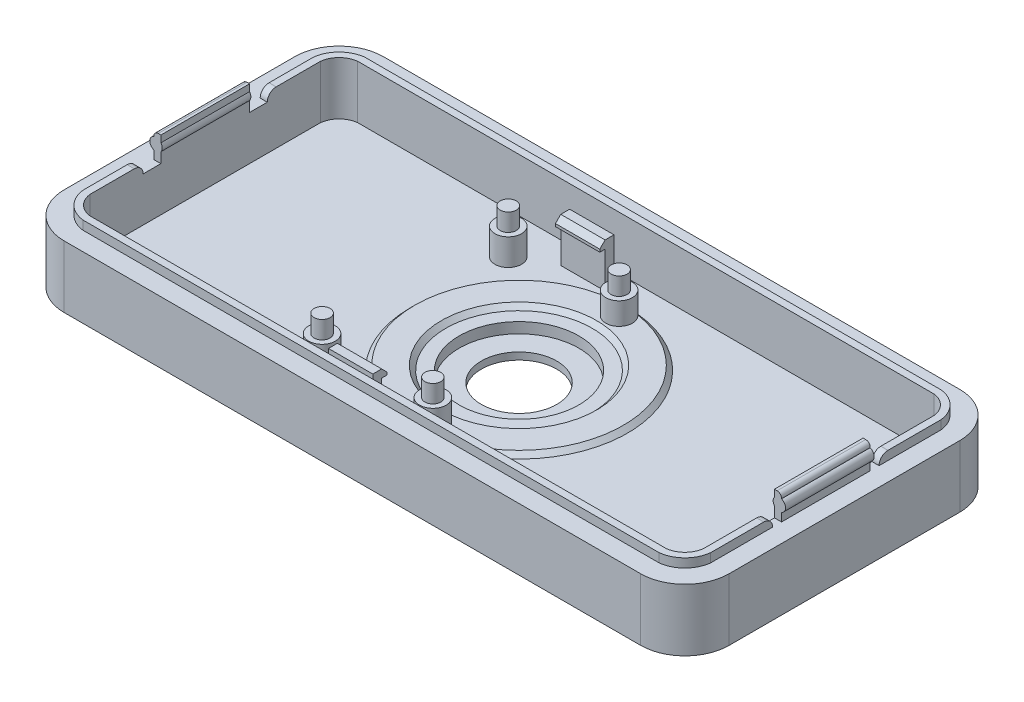
from build123d import *

# Parameters (mm, degrees)
EXTRUDE_2_DEPTH     = 7
EXTRUDE_4_DEPTH     = 1
SKETCH_7_W          = 0.8
SKETCH_7_H          = 10
EXTRUDE_8_DEPTH     = 2.8
SKETCH_8_R          = 0.7
EXTRUDE_9_DEPTH     = 10
FILLET_3_R          = 0.5
SKETCH_13_W         = 0.8
SKETCH_13_H         = 2
CUT_EXTRUDE_2_DEPTH = 1
CUT_EXTRUDE_START   = -5
CUT_EXTRUDE_3_DEPTH = 5
SKETCH_19_R         = 4.25
CUT_EXTRUDE_4_DEPTH = 3
SKETCH_21_R         = 1.5
EXTRUDE_11_DEPTH    = 3
SKETCH_22_R         = 0.9
EXTRUDE_12_DEPTH    = 2
SKETCH_28_W         = 5
SKETCH_28_H         = 1
EXTRUDE_16_DEPTH    = 5
FILLET_4_R          = 1
SKETCH_29_W         = 5
SKETCH_29_H         = 0.9
EXTRUDE_17_DEPTH    = 0.6
SKETCH_30_W         = 5
SKETCH_30_H         = 0.9
EXTRUDE_18_DEPTH    = 0.6
CHAMFER_5_SIZE      = 0.6
CUT_EXTRUDE_5_DEPTH = 0.5
SKETCH_34_W         = 0.8
SKETCH_34_H         = 12
CUT_EXTRUDE_6_DEPTH = 1
SKETCH_35_W         = 0.8
SKETCH_35_H         = 10
EXTRUDE_19_DEPTH    = 2.8
SKETCH_36_R         = 0.7
EXTRUDE_20_DEPTH    = 10
FILLET_5_R          = 0.5
FILLET_6_R          = 1
SKETCH_37_R         = 11.75
SKETCH_37_R_2       = 9.25
CUT_EXTRUDE_7_DEPTH = 1.5
CHAMFER_6_SIZE      = 1.2
CHAMFER_7_SIZE      = 0.5
SKETCH_38_R         = 12.25
SKETCH_38_R_2       = 8.25
EXTRUDE_21_DEPTH    = 0.5
CHAMFER_8_SIZE      = 0.5
SKETCH_39_R         = 6.751783721
CUT_EXTRUDE_8_DEPTH = 1.2


# Some blends are built 0.0001 mm under size
with BuildPart() as part:
    # case 2 → 凸台-拉伸2 (new body)
    with BuildSketch(Plane(origin=(0, 0, 0), x_dir=(1, 0, 0), z_dir=(0, 1, 0))):
        with BuildLine():
            Line((-34.042196447, 18), (30.957803553, 18))
            ThreePointArc((30.957803553, 18), (34.493337459, 16.535533906), (35.957803553, 13))
            Line((35.957803553, 13), (35.957803553, -13))
            ThreePointArc((35.957803553, -13), (34.493337459, -16.535533906), (30.957803553, -18))
            Line((30.957803553, -18), (-34.042196447, -18))
            ThreePointArc((-34.042196447, -18), (-37.577730353, -16.535533906), (-39.042196447, -13))
            Line((-39.042196447, -13), (-39.042196447, 13))
            ThreePointArc((-39.042196447, 13), (-37.577730353, 16.535533906), (-34.042196447, 18))
        make_face()
    extrude(amount=EXTRUDE_2_DEPTH)

    # 草图3 → 凸台-拉伸4 (add)
    with BuildSketch(Plane(origin=(0, 7, 0), x_dir=(1, 0, 0), z_dir=(0, 1, 0))):
        with BuildLine():
            Line((-36.942196447, 13), (-36.942196447, -13))
            ThreePointArc((-36.942196447, -13), (-35.997398295, -14.955201848), (-34.042196447, -15.9))
            Line((-34.042196447, -15.9), (30.957803553, -15.9))
            ThreePointArc((30.957803553, -15.9), (32.913005401, -14.955201848), (33.857803553, -13))
            Line((33.857803553, -13), (33.857803553, 13))
            ThreePointArc((33.857803553, 13), (32.913005401, 14.955201848), (30.957803553, 15.9))
            Line((30.957803553, 15.9), (-34.042196447, 15.9))
            ThreePointArc((-34.042196447, 15.9), (-35.997398295, 14.955201848), (-36.942196447, 13))
        make_face()
        with BuildLine():
            Line((-34.042196447, -15.1), (30.957803553, -15.1))
            ThreePointArc((30.957803553, -15.1), (32.371630665, -14.413827112), (33.057803553, -13))
            Line((33.057803553, -13), (33.057803553, 13))
            ThreePointArc((33.057803553, 13), (32.371630665, 14.413827112), (30.957803553, 15.1))
            Line((30.957803553, 15.1), (-34.042196447, 15.1))
            ThreePointArc((-34.042196447, 15.1), (-35.456023559, 14.413827112), (-36.142196447, 13))
            Line((-36.142196447, 13), (-36.142196447, -13))
            ThreePointArc((-36.142196447, -13), (-35.456023559, -14.413827112), (-34.042196447, -15.1))
        make_face(mode=Mode.SUBTRACT)
    extrude(amount=EXTRUDE_4_DEPTH)

    # 草图7 → 凸台-拉伸8 (add)
    with BuildSketch(Plane(origin=(0, 7, 0), x_dir=(1, 0, 0), z_dir=(0, 1, 0))):
        with Locations((-36.542196447, 0)):
            Rectangle(SKETCH_7_W, SKETCH_7_H)
    extrude(amount=EXTRUDE_8_DEPTH)

    # 草图8 → 凸台-拉伸9 (add)
    with BuildSketch(Plane.XY.offset(5)):
        with Locations((-36.692196447, 8.6)):
            Circle(SKETCH_8_R)
    extrude(amount=-EXTRUDE_9_DEPTH)

    # 圆角3
    fillet_3_edges = [part.edges().sort_by_distance(p)[0] for p in [
        (-36.942196447, 9.8, 0),
    ]]
    fillet(fillet_3_edges, radius=FILLET_3_R)

    # 草图13 → 切除-拉伸2 (cut)
    with BuildSketch(Plane(origin=(0, 8, 0), x_dir=(1, 0, 0), z_dir=(0, 1, 0))):
        with Locations((-36.542196447, -6)):
            Rectangle(SKETCH_13_W, SKETCH_13_H)
        with Locations((-36.542196447, 6)):
            Rectangle(SKETCH_13_W, SKETCH_13_H)
    extrude(amount=-CUT_EXTRUDE_2_DEPTH, mode=Mode.SUBTRACT)

    # 草图15 → 切除-拉伸3 (cut)
    with BuildSketch(Plane(origin=(0, 7, 0), x_dir=(1, 0, 0), z_dir=(0, 1, 0)).offset(CUT_EXTRUDE_START)):
        with BuildLine():
            Line((-34.042196447, -15.1), (30.957803553, -15.1))
            ThreePointArc((30.957803553, -15.1), (32.371630665, -14.413827112), (33.057803553, -13))
            Line((33.057803553, -13), (33.057803553, 13))
            ThreePointArc((33.057803553, 13), (32.371630665, 14.413827112), (30.957803553, 15.1))
            Line((30.957803553, 15.1), (-34.042196447, 15.1))
            ThreePointArc((-34.042196447, 15.1), (-35.456023559, 14.413827112), (-36.142196447, 13))
            Line((-36.142196447, 13), (-36.142196447, -13))
            ThreePointArc((-36.142196447, -13), (-35.456023559, -14.413827112), (-34.042196447, -15.1))
        make_face()
    extrude(amount=CUT_EXTRUDE_3_DEPTH, mode=Mode.SUBTRACT)

    # 草图19 → 切除-拉伸4 (cut)
    with BuildSketch(Plane(origin=(0, 2, 0), x_dir=(1, 0, 0), z_dir=(0, 1, 0))):
        with Locations(Location((-0.749999997, 0, 0), (0, 0, 270))):
            Circle(SKETCH_19_R)
    extrude(amount=-CUT_EXTRUDE_4_DEPTH, mode=Mode.SUBTRACT)

    # 草图21 → 凸台-拉伸11 (add)
    with BuildSketch(Plane(origin=(0, 2, 0), x_dir=(1, 0, 0), z_dir=(0, 1, 0))):
        with Locations(Location((-12.465269631, 10.5, 0), (0, 0, 270))):
            Circle(SKETCH_21_R)
        with Locations(Location((0.034730369, 10.5, 0), (0, 0, 270))):
            Circle(SKETCH_21_R)
        with Locations(Location((-12.465269631, -10.5, 0), (0, 0, 270))):
            Circle(SKETCH_21_R)
        with Locations(Location((0.034730369, -10.5, 0), (0, 0, 270))):
            Circle(SKETCH_21_R)
    extrude(amount=EXTRUDE_11_DEPTH)

    # 草图22 → 凸台-拉伸12 (add)
    with BuildSketch(Plane(origin=(0, 5, 0), x_dir=(1, 0, 0), z_dir=(0, 1, 0))):
        with Locations(Location((-12.465269631, -10.5, 0), (0, 0, 270))):
            Circle(SKETCH_22_R)
        with Locations(Location((0.034730369, -10.5, 0), (0, 0, 270))):
            Circle(SKETCH_22_R)
        with Locations(Location((-12.465269631, 10.5, 0), (0, 0, 270))):
            Circle(SKETCH_22_R)
        with Locations(Location((0.034730369, 10.5, 0), (0, 0, 270))):
            Circle(SKETCH_22_R)
    extrude(amount=EXTRUDE_12_DEPTH)

    # 草图28 → 凸台-拉伸16 (add)
    with BuildSketch(Plane(origin=(0, 2, 0), x_dir=(1, 0, 0), z_dir=(0, 1, 0))):
        with Locations((-6.142196447, -13.1)):
            Rectangle(SKETCH_28_W, SKETCH_28_H)
        with Locations((-6.142196447, 13.1)):
            Rectangle(SKETCH_28_W, SKETCH_28_H)
    extrude(amount=EXTRUDE_16_DEPTH)

    # 圆角4
    fillet_4_edges = [part.edges().sort_by_distance(p)[0] for p in [
        (-6.142196447, 2, 13.6),
        (-6.142196447, 2, -13.6),
    ]]
    fillet(fillet_4_edges, radius=FILLET_4_R)

    # 草图29 → 凸台-拉伸17 (add)
    with BuildSketch(Plane(origin=(0, 0, 12.6), x_dir=(-1, 0, 0), z_dir=(0, 0, -1))):
        with Locations((6.142196447, 6.55)):
            Rectangle(SKETCH_29_W, SKETCH_29_H)
    extrude(amount=EXTRUDE_17_DEPTH)

    # 草图30 → 凸台-拉伸18 (add)
    with BuildSketch(Plane.XY.offset(-12.6)):
        with Locations((-6.142196447, 6.55)):
            Rectangle(SKETCH_30_W, SKETCH_30_H)
    extrude(amount=EXTRUDE_18_DEPTH)

    # 倒角5
    chamfer_5_edges = [part.edges().sort_by_distance(p)[0] for p in [
        (-6.142196447, 7, 12),
        (-6.142196447, 7, -12),
    ]]
    chamfer(chamfer_5_edges, length=CHAMFER_5_SIZE)

    # 草图33 → 切除-拉伸5 (cut)
    with BuildSketch(Plane.XZ):
        with BuildLine():
            Line((31.452844049, 12.8823111), (31.128302993, 13.069384422))
            Line((31.128302993, 13.069384422), (29.444684359, 14.04079281))
            Line((29.444684359, 14.04079281), (29.120143303, 14.230122183))
            add(Edge.make_bspline(
                [(29.120143303, 14.230122183), (29.014191488, 14.288710703), (28.897014448, 14.320267891), (28.779809896, 14.320267891)],
                knots=[3, 3, 3, 3, 4, 4, 4, 4], degree=3))
            add(Edge.make_bspline(
                [(28.779809896, 14.320267891), (28.662605343, 14.320267891), (28.545400791, 14.288710703), (28.439476489, 14.230122183)],
                knots=[4, 4, 4, 4, 5, 5, 5, 5], degree=3))
            Line((28.439476489, 14.230122183), (28.11490792, 14.04079281))
            Line((28.11490792, 14.04079281), (26.431289286, 13.069384422))
            Line((26.431289286, 13.069384422), (26.106720717, 12.8823111))
            add(Edge.make_bspline(
                [(26.106720717, 12.8823111), (25.897128163, 12.760608203), (25.76638731, 12.535223299), (25.76638731, 12.2940598)],
                knots=[8, 8, 8, 8, 9, 9, 9, 9], degree=3))
            Line((25.76638731, 12.2940598), (25.76638731, 9.59845139))
            add(Edge.make_bspline(
                [(25.76638731, 9.59845139), (25.76638731, 9.355045597), (25.897128163, 9.131902987), (26.106720717, 9.01020009)],
                knots=[10, 10, 10, 10, 11, 11, 11, 11], degree=3))
            Line((26.106720717, 9.01020009), (26.431289286, 8.823126768))
            Line((26.431289286, 8.823126768), (28.11490792, 7.851718379))
            Line((28.11490792, 7.851718379), (28.439476489, 7.662402763))
            add(Edge.make_bspline(
                [(28.439476489, 7.662402763), (28.545400791, 7.601544437), (28.662605343, 7.572243299), (28.779809896, 7.572243299)],
                knots=[14, 14, 14, 14, 15, 15, 15, 15], degree=3))
            add(Edge.make_bspline(
                [(28.779809896, 7.572243299), (28.897014448, 7.572243299), (29.014191488, 7.601544437), (29.120143303, 7.662402763)],
                knots=[15, 15, 15, 15, 16, 16, 16, 16], degree=3))
            Line((29.120143303, 7.662402763), (29.444684359, 7.851718379))
            Line((29.444684359, 7.851718379), (31.128302993, 8.823126768))
            Line((31.128302993, 8.823126768), (31.452844049, 9.01020009))
            add(Edge.make_bspline(
                [(31.452844049, 9.01020009), (31.664720166, 9.131902987), (31.793177456, 9.355045597), (31.793177456, 9.59845139)],
                knots=[19, 19, 19, 19, 20, 20, 20, 20], degree=3))
            Line((31.793177456, 9.59845139), (31.793177456, 12.2940598))
            add(Edge.make_bspline(
                [(31.793177456, 12.2940598), (31.793177456, 12.535223299), (31.664720166, 12.760608203), (31.452844049, 12.8823111)],
                knots=[21, 21, 21, 21, 22, 22, 22, 22], degree=3))
        make_face()
        with BuildLine():
            Line((26.539469638, 12.614102513), (28.622023955, 13.817663956))
            add(Edge.make_bspline(
                [(28.622023955, 13.817663956), (28.71895157, 13.874010182), (28.840668222, 13.874010182), (28.939824374, 13.817663956)],
                knots=[3, 3, 3, 3, 4, 4, 4, 4], degree=3))
            Line((28.939824374, 13.817663956), (31.011098441, 12.611846463))
            add(Edge.make_bspline(
                [(31.011098441, 12.611846463), (31.117022743, 12.551001893), (31.119278793, 12.397741809), (31.013354491, 12.334627432)],
                knots=[5, 5, 5, 5, 6, 6, 6, 6], degree=3))
            Line((31.013354491, 12.334627432), (29.0006827, 11.131079746))
            add(Edge.make_bspline(
                [(29.0006827, 11.131079746), (28.865429747, 11.052186775), (28.696391069, 11.052186775), (28.561165629, 11.131079746)],
                knots=[7, 7, 7, 7, 8, 8, 8, 8], degree=3))
            add(Edge.make_bspline(
                [(28.561165629, 11.131079746), (26.5237048, 12.307582344), (26.5191927, 12.309838394)],
                knots=[0, 0, 0, 1, 1, 1], degree=2))
            add(Edge.make_bspline(
                [(26.5191927, 12.309838394), (26.413268398, 12.386461558), (26.424521136, 12.548745843), (26.539469638, 12.614102513)],
                knots=[1, 1, 1, 1, 2, 2, 2, 2], degree=3))
        make_face(mode=Mode.SUBTRACT)
        with BuildLine():
            Line((29.625003288, 9.091335354), (29.390594183, 8.960622014))
            Line((29.390594183, 8.960622014), (29.390594183, 9.388845079))
            Line((29.390594183, 9.388845079), (29.597930687, 9.492527088))
            add(Edge.make_bspline(
                [(29.976589432, 10.040210755), (29.976589432, 9.826092344), (29.854900293, 9.636776728), (29.597930687, 9.492527088)],
                knots=[0, 0, 0, 0, 1, 1, 1, 1], degree=3))
            add(Edge.make_bspline(
                [(29.584421899, 10.114591625), (29.836851892, 10.258827509), (29.976589432, 10.261083559), (29.976589432, 10.040210755)],
                knots=[6, 6, 6, 6, 7, 7, 7, 7], degree=3))
            Line((29.584421899, 10.114591625), (29.390594183, 10.006397517))
            add(Edge.make_bspline(
                [(29.368033682, 9.968085935), (29.368033682, 9.983864529), (29.377057883, 9.999643123), (29.390594183, 10.006397517)],
                knots=[4, 4, 4, 4, 5, 5, 5, 5], degree=3))
            Line((29.368033682, 9.968085935), (29.368033682, 9.436180861))
            Line((29.368033682, 9.436180861), (29.368033682, 8.922296676))
            Line((29.368033682, 8.922296676), (29.368033682, 8.246141962))
            add(Edge.make_bspline(
                [(29.368033682, 8.246141962), (29.368033682, 8.230363368), (29.361293045, 8.216840824), (29.345528207, 8.20783038)],
                knots=[3, 3, 3, 3, 4, 4, 4, 4], degree=3))
            Line((29.345528207, 8.20783038), (28.908267186, 7.959912488))
            add(Edge.make_bspline(
                [(28.908267186, 7.959912488), (28.878966048, 7.944133894), (28.842896759, 7.964410832), (28.842896759, 7.99822407)],
                knots=[5, 5, 5, 5, 6, 6, 6, 6], degree=3))
            Line((28.842896759, 7.99822407), (28.842896759, 10.085290487))
            add(Edge.make_bspline(
                [(28.842896759, 10.085290487), (28.842896759, 10.101069081), (28.84966491, 10.116847675), (28.865429747, 10.123602069)],
                knots=[7, 7, 7, 7, 8, 8, 8, 8], degree=3))
            Line((28.865429747, 10.123602069), (29.609210937, 10.54507074))
            add(Edge.make_bspline(
                [(29.609210937, 10.54507074), (30.091537935, 10.817791427), (30.490446105, 10.871881603), (30.490446105, 10.330952329)],
                knots=[9, 9, 9, 9, 10, 10, 10, 10], degree=3))
            add(Edge.make_bspline(
                [(30.490446105, 10.330952329), (30.490446105, 9.81031375), (30.087025835, 9.352789547), (29.625003288, 9.091335354)],
                knots=[10, 10, 10, 10, 11, 11, 11, 11], degree=3))
        make_face(mode=Mode.SUBTRACT)
        with BuildLine():
            Line((31.168856869, 9.231072895), (30.73613546, 8.985411052))
            add(Edge.make_bspline(
                [(30.73613546, 8.985411052), (30.706834322, 8.969632458), (30.670765034, 8.989923153), (30.670765034, 9.023722634)],
                knots=[2, 2, 2, 2, 3, 3, 3, 3], degree=3))
            Line((30.670765034, 9.023722634), (30.670765034, 10.017677767))
            add(Edge.make_bspline(
                [(30.670765034, 10.017677767), (30.670765034, 10.033442605), (30.679789234, 10.046978905), (30.693325534, 10.055989349)],
                knots=[4, 4, 4, 4, 5, 5, 5, 5], degree=3))
            Line((30.693325534, 10.055989349), (31.126046943, 10.299408898))
            add(Edge.make_bspline(
                [(31.126046943, 10.299408898), (31.155348081, 10.315173735), (31.191417369, 10.294896798), (31.191417369, 10.261083559)],
                knots=[6, 6, 6, 6, 7, 7, 7, 7], degree=3))
            Line((31.191417369, 10.261083559), (31.191417369, 9.269398233))
            add(Edge.make_bspline(
                [(31.191417369, 9.269398233), (31.191417369, 9.253619639), (31.182393169, 9.237841045), (31.168856869, 9.231072895)],
                knots=[0, 0, 0, 0, 1, 1, 1, 1], degree=3))
        make_face(mode=Mode.SUBTRACT)
        with BuildLine():
            add(Edge.make_bspline(
                [(30.932219227, 10.959785017), (31.105770005, 11.058954925), (31.229715195, 11.016131243), (31.229715195, 10.858359059), (31.229715195, 10.702842924), (31.105770005, 10.520281702), (30.932219227, 10.423367844)],
                knots=[2, 2, 2, 2, 3, 3, 3, 4, 4, 4, 4], degree=3))
            add(Edge.make_bspline(
                [(30.932219227, 10.423367844), (30.756439911, 10.321941886), (30.632467208, 10.364765568), (30.632467208, 10.520281702), (30.632467208, 10.680309937), (30.756439911, 10.860615109), (30.932219227, 10.959785017)],
                knots=[0, 0, 0, 0, 1, 1, 1, 2, 2, 2, 2], degree=3))
        make_face(mode=Mode.SUBTRACT)
    extrude(amount=-CUT_EXTRUDE_5_DEPTH, mode=Mode.SUBTRACT)

    # 草图34 → 切除-拉伸6 (cut)
    with BuildSketch(Plane(origin=(0, 8, 0), x_dir=(1, 0, 0), z_dir=(0, 1, 0))):
        with Locations((33.457803553, 0)):
            Rectangle(SKETCH_34_W, SKETCH_34_H)
    extrude(amount=-CUT_EXTRUDE_6_DEPTH, mode=Mode.SUBTRACT)

    # 草图35 → 凸台-拉伸19 (add)
    with BuildSketch(Plane(origin=(0, 7, 0), x_dir=(1, 0, 0), z_dir=(0, 1, 0))):
        with Locations((33.457803553, 0)):
            Rectangle(SKETCH_35_W, SKETCH_35_H)
    extrude(amount=EXTRUDE_19_DEPTH)

    # 草图36 → 凸台-拉伸20 (add)
    with BuildSketch(Plane(origin=(0, 0, -5), x_dir=(-1, 0, 0), z_dir=(0, 0, -1))):
        with Locations((-33.609627041, 8.6)):
            Circle(SKETCH_36_R)
    extrude(amount=-EXTRUDE_20_DEPTH)

    # 圆角5
    fillet_5_edges = [part.edges().sort_by_distance(p)[0] for p in [
        (33.857803553, 9.8, 0),
    ]]
    fillet(fillet_5_edges, radius=FILLET_5_R)

    # 圆角6
    fillet_6_edges = [part.edges().sort_by_distance(p)[0] for p in [
        (33.457803553, 8, -6),
        (33.457803553, 8, 6),
        (-36.542196447, 8, 7),
        (-36.542196447, 8, -7),
    ]]
    fillet(fillet_6_edges, radius=FILLET_6_R - 0.0001)  # a hair under: the kernel refuses the full size

    # 草图37 → 切除-拉伸7 (cut)
    with BuildSketch(Plane.XZ):
        with Locations(Location((-0.749999997, 0, 0), (0, 0, 270))):
            Circle(SKETCH_37_R)
        with Locations(Location((-0.749999997, 0, 0), (0, 0, 270))):
            Circle(SKETCH_37_R_2, mode=Mode.SUBTRACT)
    extrude(amount=-CUT_EXTRUDE_7_DEPTH, mode=Mode.SUBTRACT)

    # 倒角6
    chamfer_6_edges = [part.edges().sort_by_distance(p)[0] for p in [
        (-0.749999997, 0, 9.25),
    ]]
    chamfer(chamfer_6_edges, length=CHAMFER_6_SIZE)

    # 倒角7
    chamfer_7_edges = [part.edges().sort_by_distance(p)[0] for p in [
        (-0.749999997, 0, 11.75),
    ]]
    chamfer(chamfer_7_edges, length=CHAMFER_7_SIZE)

    # 草图38 → 凸台-拉伸21 (add)
    with BuildSketch(Plane(origin=(0, 2, 0), x_dir=(1, 0, 0), z_dir=(0, 1, 0))):
        with Locations(Location((-0.749999997, 0, 0), (0, 0, 270))):
            Circle(SKETCH_38_R)
        with Locations(Location((-0.749999997, 0, 0), (0, 0, 270))):
            Circle(SKETCH_38_R_2, mode=Mode.SUBTRACT)
    extrude(amount=EXTRUDE_21_DEPTH)

    # 倒角8
    # the kernel refuses this chamfer: 0.5 mm, written as the material it takes off along each edge
    with BuildSketch(Plane(origin=(-0.749999997, 2.5, 0), x_dir=(0, 0, 1), z_dir=(-1, 0, 0))) as chamfer_8_piece_1_section:
        Polygon((12.25, -CHAMFER_8_SIZE), (12.25 - CHAMFER_8_SIZE, 0), (12.25, 0), align=None)
    chamfer_8_piece_1 = revolve(axis=Axis((-0.749999997, 2.5, 0), (0, 1, 0)), mode=Mode.PRIVATE)
    chamfer_8_piece_1 = split(chamfer_8_piece_1, bisect_by=Plane(origin=(-0.749999997, 2, -12.008331629), z_dir=(0, 1, 0)), keep=Keep.TOP, mode=Mode.PRIVATE)
    chamfer_8_piece_1 = chamfer_8_piece_1 - Plane(origin=(0.034730369, 2.272473764, 10.5), x_dir=(0, 0, 1), z_dir=(0, -1, 0)) * Cylinder(1.5, 49, mode=Mode.PRIVATE)
    chamfer_8_piece_1 = chamfer_8_piece_1 - Plane(origin=(0.034730369, 2.272473764, -10.5), x_dir=(0, 0, 1), z_dir=(0, -1, 0)) * Cylinder(1.5, 49, mode=Mode.PRIVATE)
    add(chamfer_8_piece_1, mode=Mode.SUBTRACT)
    with BuildSketch(Plane(origin=(-0.749999997, 2.5, 0), x_dir=(0, 0, 1), z_dir=(-1, 0, 0))) as chamfer_8_piece_2_section:
        Polygon((8.25, -CHAMFER_8_SIZE), (8.25 + CHAMFER_8_SIZE, 0), (8.25, 0), align=None)
    chamfer_8_piece_2 = revolve(axis=Axis((-0.749999997, 2.5, 0), (0, 1, 0)), mode=Mode.PRIVATE)
    chamfer_8_piece_2 = split(chamfer_8_piece_2, bisect_by=Plane(origin=(-0.749999997, 2, -8.493378634), z_dir=(0, 1, 0)), keep=Keep.TOP, mode=Mode.PRIVATE)
    add(chamfer_8_piece_2, mode=Mode.SUBTRACT)

    # 草图39 → 切除-拉伸8 (cut)
    with BuildSketch(Plane(origin=(0, 2, 0), x_dir=(1, 0, 0), z_dir=(0, 1, 0))):
        with Locations(Location((-0.749999997, 0, 0), (0, 0, 270))):
            Circle(SKETCH_39_R)
    extrude(amount=-CUT_EXTRUDE_8_DEPTH, mode=Mode.SUBTRACT)


solid = part.part
